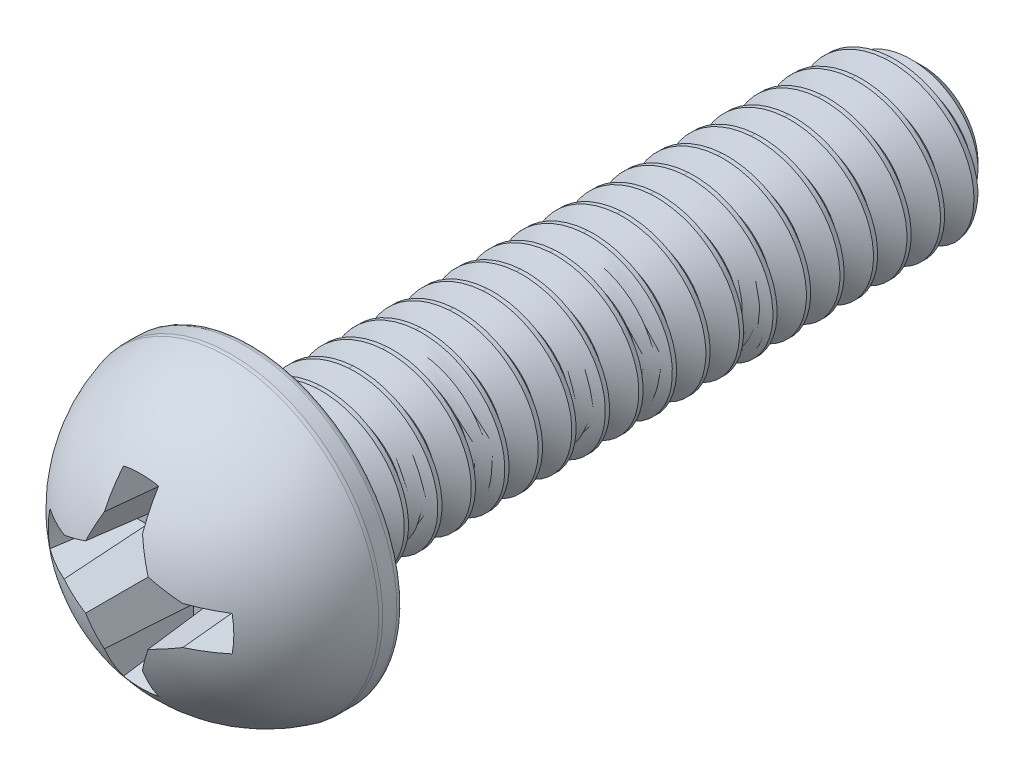
from build123d import *

# Parameters (mm, degrees)
SKETCH1_R          = 1.4350999999999998
EXTRUDE3_DEPTH     = 1.3461999999999998
CHAMFER1_SIZE      = 0.23812500000000003
CUT_SWEEP1_PITCH   = 0.31749999999999956
CUT_SWEEP1_TO      = 6.35
SKETCH26_R         = 0.5461
EXTRUDE12_DEPTH    = 0.235297
CUT_EXTRUDE3_DEPTH = 0.8974666666666667
CIRPATTERN1_COUNT  = 4
DRAFT1_ANGLE       = 15.000000000000034
DRAFT2_ANGLE       = 5.000000000000011


with BuildPart() as part:
    # Sketch1 → Extrude3 (new body)
    with BuildSketch(Plane.XY):
        Circle(SKETCH1_R)
    extrude(amount=EXTRUDE3_DEPTH)

    # Sketch11 → Cut-Revolve3 (revolve, cut)
    with BuildSketch(Plane(origin=(0, 0, 0), x_dir=(0, 0, -1), z_dir=(1, 0, 0))):
        with BuildLine():
            Line((-1.6001999999999996, 1.654810000000003), (2e-15, 1.654810000000003))
            Line((2e-15, 1.654810000000003), (2.02e-15, 1.3677900000000007))
            ThreePointArc((2.02e-15, 1.3677900000000007), (-0.01971464255833238, 1.4153853574416666), (-0.06730999999999794, 1.4350999999999998))
            Line((-0.06730999999999794, 1.4350999999999998), (-0.20192999999999806, 1.4350999999999998))
            ThreePointArc((-0.20192999999999806, 1.4350999999999998), (-0.2187450344693335, 1.4340457104791304), (-0.23529669180846433, 1.4308993554567675))
            ThreePointArc((-0.23529669180846433, 1.4308993554567675), (-1.0358730684342707, 0.9057564691457478), (-1.3461999999999996, 2.2e-16))
            Line((-1.3461999999999996, 2.2e-16), (-1.6001999999999996, -2e-16))
            Line((-1.6001999999999996, -2e-16), (-1.6001999999999996, 1.654810000000003))
        make_face()
    revolve(axis=Axis((0, 0, 0), (0, -1.2e-16, 1)), mode=Mode.SUBTRACT)



with BuildPart() as body_2:
    # Sketch4 → Revolve1 (revolve)
    with BuildSketch(Plane(origin=(0, 0, 0), x_dir=(0, 0, -1), z_dir=(1, 0, 0))):
        Polygon((0, 0), (6.350000000000001, 0), (6.350000000000001, 0.7619999999999979), (3e-17, 0.7619999999999936), align=None)
    revolve(axis=Axis((0, 0, 0), (0, 0, -1)))

    # Chamfer1
    chamfer1_edges = [body_2.edges().sort_by_distance(p)[0] for p in [
        (4.3e-16, -0.7619999999999979, -6.350000000000001),
    ]]
    chamfer(chamfer1_edges, length=CHAMFER1_SIZE)

    # Cut-Sweep1: arcs per turn and ends read off the stored shape
    # Cut-Sweep1: the profile of Sketch14 profile screwed along a right-hand helix through 21 turns, 6 arcs to a turn; built about Z, then put on its axis
    cut_sweep1_z = Axis((0, 0, 0), (0, 0, 1))
    cut_sweep1_corners = [(0.7623, 3.99e-07, -0.079208681), (0.7623, 3.99e-07, -0.357353766), (0.547205564, 2.87e-07, -0.238124974), (0.547205564, 2.87e-07, -0.198437474)]
    with BuildLine(mode=Mode.PRIVATE) as cut_sweep1_profile:
        Line(cut_sweep1_corners[0], cut_sweep1_corners[1])
        Line(cut_sweep1_corners[1], cut_sweep1_corners[2])
        Line(cut_sweep1_corners[2], cut_sweep1_corners[3])
        Line(cut_sweep1_corners[3], cut_sweep1_corners[0])
    cut_sweep1_cap = Face(cut_sweep1_profile.wire())
    cut_sweep1_turn_angles = [0, 30, 60, 90, 120, 150, 180, 210, 240, 270, 300, 330, 360]
    cut_sweep1_turn_weights = [1, 0.8660254037844387, 1, 0.8660254037844387, 1, 0.8660254037844387, 1, 0.8660254037844387, 1, 0.8660254037844387, 1, 0.8660254037844387, 1]
    cut_sweep1_turn_rails = [Edge.make_bspline([Vector(p[0], p[1], 0).rotate(cut_sweep1_z, cut_sweep1_turn_angles[k]) / cut_sweep1_turn_weights[k] + Vector(0, 0, p[2] + CUT_SWEEP1_PITCH * cut_sweep1_turn_angles[k] / 360) for k in range(13)], [0, 0, 0, 1, 1, 2, 2, 3, 3, 4, 4, 5, 5, 6, 6, 6], 2, cut_sweep1_turn_weights) for p in cut_sweep1_corners]
    cut_sweep1_turn_sides = [Face.make_surface_from_curves(cut_sweep1_turn_rails[p[0]], cut_sweep1_turn_rails[p[1]]) for p in [(0, 1), (1, 2), (2, 3), (3, 0)]]
    cut_sweep1 = Plane(origin=(0, 0, -6.350000000000002), x_dir=(1, -3.49e-15, 0), z_dir=(0, 0, 1)) * split(Solid(Shell([*[p.moved(Location((0, 0, CUT_SWEEP1_PITCH * i))) for i in range(21) for p in cut_sweep1_turn_sides], cut_sweep1_cap, cut_sweep1_cap.rotate(cut_sweep1_z, 7560).moved(Location((0, 0, CUT_SWEEP1_PITCH * 7560 / 360)))])), bisect_by=Plane.XY.offset(CUT_SWEEP1_TO), keep=Keep.BOTTOM, mode=Mode.PRIVATE)
    add(cut_sweep1, mode=Mode.SUBTRACT)


with BuildPart() as part_1:
    add(part.part)

    add(body_2.part)  # Extrude12 merges body 2
    # Sketch26 → Extrude12 (add)
    with BuildSketch(Plane.XY):
        Circle(SKETCH26_R)
    extrude(amount=EXTRUDE12_DEPTH)

    # Sketch12 → Cut-Extrude3 (cut)
    with BuildSketch(Plane.XY.offset(1.3461999999999994)):
        with BuildLine():
            Line((0.9374033946315036, 0.19134666666666764), (0.564375030649085, 0.19134666666666655))
            Line((0.564375030649085, 0.19134666666666655), (0.30060414490219345, 0.30060414490219345))
            Line((0.30060414490219345, 0.30060414490219345), (0.19134666666666675, 0.5643750306490855))
            Line((0.19134666666666675, 0.5643750306490855), (0.19134666666666675, 0.9374033946315036))
            ThreePointArc((0.19134666666666675, 0.9374033946315036), (0.09616027424911623, 0.9518885821184355), (0, 0.9567333333333335))
            Line((0, 0.9567333333333335), (0, 3.3e-16))
            Line((0, 3.3e-16), (0.9567333333333335, 1.1e-16))
            ThreePointArc((0.9567333333333335, 1.1e-16), (0.9518885821184359, 0.09616027424911672), (0.9374033946315036, 0.19134666666666764))
        make_face()
    cut_extrude3 = extrude(amount=-CUT_EXTRUDE3_DEPTH, mode=Mode.SUBTRACT)

    # CirPattern1: Cut-Extrude3 ×4 about axis
    cirpattern1_axis = Axis((0, -2e-17, 0), (0, 0, 1))
    for i in range(1, CIRPATTERN1_COUNT):
        add(cut_extrude3.rotate(cirpattern1_axis, i * 360 / CIRPATTERN1_COUNT), mode=Mode.SUBTRACT)

    # Draft1
    draft1_faces = [part_1.faces().sort_by_distance(p)[0] for p in [
        (-0.9567333333333335, -2.96e-15, 0.7215902238243765),
        (2.86e-15, -0.9567333333333334, 0.7215902238243768),
        (0.9567333333333335, 2.89e-15, 0.7215902238243767),
        (-4.5e-16, 0.9567333333333334, 0.7215902238243763),
    ]]
    draft(draft1_faces, Plane.XY.offset(1.3461999999999994), DRAFT1_ANGLE)

    # Draft2
    draft2_faces = [part_1.faces().sort_by_distance(p)[0] for p in [
        (0.19134666666666675, 0.6734496647986254, 0.8477552967018102),
        (0.24668385286116284, 0.4307792452347676, 0.8532286029808229),
        (0.4307792452347674, 0.24668385286116276, 0.8532286029808228),
        (0.6734496592332562, 0.19134666666666686, 0.8477552659425496),
        (0.6734496592332557, -0.19134666666666691, 0.8477552659425504),
        (0.4307792452347676, -0.24668385286116296, 0.8532286029808229),
        (0.24668385286116268, -0.43077924523476746, 0.853228602980823),
        (0.19134666666666675, -0.6734496592332562, 0.84775526594255),
        (-0.19134666666666683, -0.6734496592332557, 0.8477552659425504),
        (-0.2466838528611629, -0.4307792452347677, 0.8532286029808228),
        (-0.43077924523476746, -0.24668385286116276, 0.8532286029808229),
        (-0.6734496592332561, -0.19134666666666683, 0.8477552659425496),
        (-0.6734496592332557, 0.1913466666666668, 0.8477552659425504),
        (-0.4307792452347676, 0.2466838528611629, 0.8532286029808228),
        (-0.24668385286116273, 0.43077924523476746, 0.8532286029808229),
        (-0.19134666666666683, 0.673449659233254, 0.8477552659425488),
    ]]
    draft(draft2_faces, Plane.XY.offset(1.3461999999999994), DRAFT2_ANGLE)


solid = part_1.part
